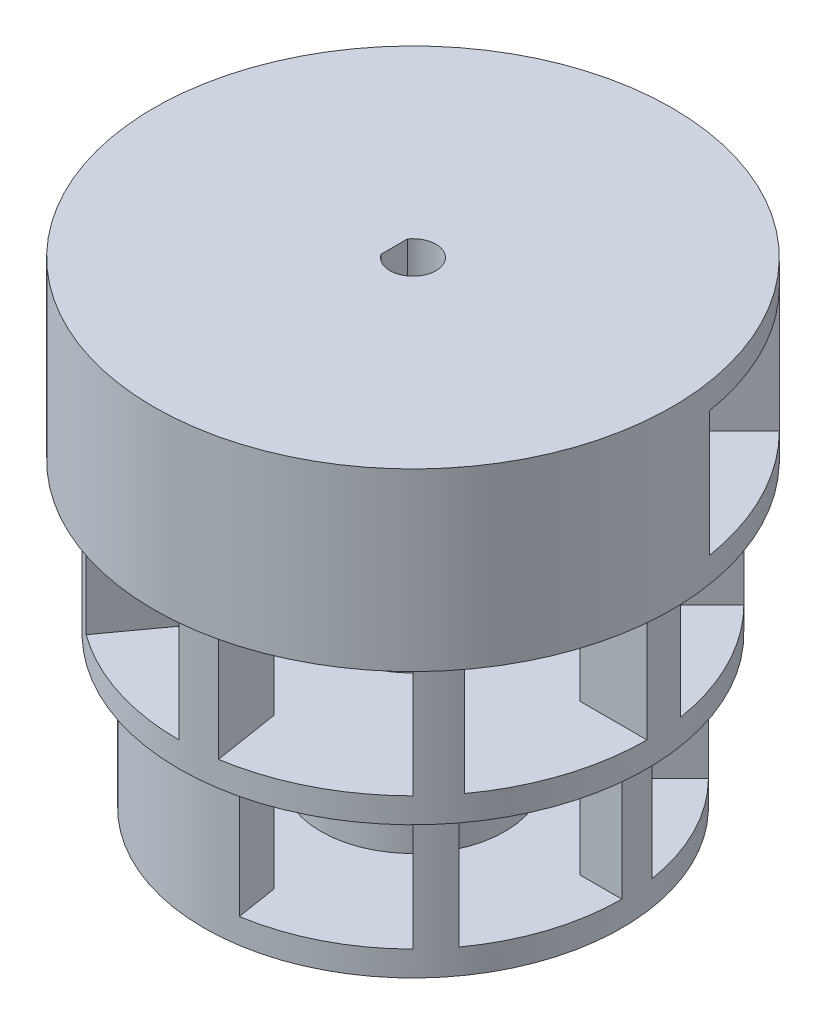
from build123d import *
from build123d.topology import SkipClean

# Parameters (mm, degrees)
SKETCH1_R           = 25
SKETCH1_R_2         = 8
BOSS_EXTRUDE1_DEPTH = 3
SKETCH2_R           = 11
BOSS_EXTRUDE2_DEPTH = 3
SKETCH3_R           = 10
SKETCH3_R_2         = 8
BOSS_EXTRUDE3_DEPTH = 15
SKETCH4_R           = 28
SKETCH4_R_2         = 8
BOSS_EXTRUDE4_DEPTH = 3
SKETCH6_R           = 10
SKETCH6_R_2         = 8
BOSS_EXTRUDE5_DEPTH = 15
SKETCH7_R           = 31
SKETCH7_R_2         = 8
BOSS_EXTRUDE6_DEPTH = 3
SKETCH9_R           = 10
SKETCH9_R_2         = 8
BOSS_EXTRUDE7_DEPTH = 15
SKETCH10_R          = 31
SKETCH10_R_2        = 8
BOSS_EXTRUDE8_DEPTH = 3
BOSS_EXTRUDE9_REACH = 73.91
SKETCH12_W          = 4.758961379
SKETCH12_H          = 12.380249671
CUT_EXTRUDE7_REACH  = 86.374
CIRPATTERN3_COUNT   = 8
CUT_EXTRUDE5_REACH  = 91.222
CIRPATTERN1_COUNT   = 8
CUT_EXTRUDE6_DEPTH  = 12.5
CIRPATTERN2_COUNT   = 8


with BuildPart() as part:
    # Sketch1 → Boss-Extrude1 (new body)
    with BuildSketch(Plane(origin=(0, 0, 0), x_dir=(1, 0, 0), z_dir=(0, 1, 0))):
        Circle(SKETCH1_R)
        Circle(SKETCH1_R_2, mode=Mode.SUBTRACT)
    extrude(amount=BOSS_EXTRUDE1_DEPTH)

    # Sketch2 → Boss-Extrude2 (add)
    with BuildSketch(Plane(origin=(0, 3, 0), x_dir=(1, 0, 0), z_dir=(0, 1, 0))):
        Circle(SKETCH2_R)
    extrude(amount=BOSS_EXTRUDE2_DEPTH)

    # Sketch3 → Boss-Extrude3 (add)
    # profile 1 of 5: a face of its own
    with BuildSketch(Plane(origin=(0, 3, 0), x_dir=(1, 0, 0), z_dir=(0, 1, 0))):
        with BuildLine():
            ThreePointArc((-11.755705046, -16.180339887), (-12.988960967, -15.208119312), (-14.142135624, -14.142135624))
            Line((-14.142135624, -14.142135624), (-16.263455967, -16.263455967))
            ThreePointArc((-16.263455967, -16.263455967), (-20.493150056, -10.441781494), (-22.716831834, -3.597992696))
            Line((-22.716831834, -3.597992696), (-19.753766812, -3.128689301))
            ThreePointArc((-19.753766812, -3.128689301), (-19.938346675, -1.569181915), (-20, 0))
            Line((-20, 0), (-23, 0))
            ThreePointArc((-23, 0), (-21.874299875, 7.107390871), (-18.607390871, 13.519060803))
            Line((-18.607390871, 13.519060803), (-16.180339887, 11.755705046))
            ThreePointArc((-16.180339887, 11.755705046), (-15.208119312, 12.988960967), (-14.142135624, 14.142135624))
            Line((-14.142135624, 14.142135624), (-16.263455967, 16.263455967))
            ThreePointArc((-16.263455967, 16.263455967), (-10.441781494, 20.493150056), (-3.597992696, 22.716831834))
            Line((-3.597992696, 22.716831834), (-3.128689301, 19.753766812))
            ThreePointArc((-3.128689301, 19.753766812), (-1.569181915, 19.938346675), (0, 20))
            Line((0, 20), (0, 25))
            ThreePointArc((0, 25), (-24.922933343, -1.961477393), (3.910861626, -24.692208515))
            Line((3.910861626, -24.692208515), (3.128689301, -19.753766812))
            ThreePointArc((3.128689301, -19.753766812), (1.569181915, -19.938346675), (0, -20))
            Line((0, -20), (0, -23))
            ThreePointArc((0, -23), (-7.107390871, -21.874299875), (-13.519060803, -18.607390871))
            Line((-13.519060803, -18.607390871), (-11.755705046, -16.180339887))
        make_face()
    # profile 2 of 5: a face of its own
    with BuildSketch(Plane(origin=(0, 3, 0), x_dir=(1, 0, 0), z_dir=(0, 1, 0))):
        with BuildLine():
            Line((14.142135624, -14.142135624), (17.67766953, -17.67766953))
            ThreePointArc((17.67766953, -17.67766953), (19.01014914, -16.236201208), (20.225424859, -14.694631307))
            Line((20.225424859, -14.694631307), (16.180339887, -11.755705046))
            ThreePointArc((16.180339887, -11.755705046), (15.208119312, -12.988960967), (14.142135624, -14.142135624))
        make_face()
    # profile 3 of 5: a face of its own
    with BuildSketch(Plane(origin=(0, 3, 0), x_dir=(1, 0, 0), z_dir=(0, 1, 0))):
        with BuildLine():
            ThreePointArc((17.67766953, 17.67766953), (16.236201208, 19.01014914), (14.694631307, 20.225424859))
            Line((14.694631307, 20.225424859), (11.755705046, 16.180339887))
            ThreePointArc((11.755705046, 16.180339887), (12.988960967, 15.208119312), (14.142135624, 14.142135624))
            Line((14.142135624, 14.142135624), (17.67766953, 17.67766953))
        make_face()
    # profile 4 of 5: a face of its own
    with BuildSketch(Plane(origin=(0, 3, 0), x_dir=(1, 0, 0), z_dir=(0, 1, 0))):
        with BuildLine():
            Line((20, 0), (25, 0))
            ThreePointArc((25, 0), (24.922933343, 1.961477393), (24.692208515, 3.910861626))
            Line((24.692208515, 3.910861626), (19.753766812, 3.128689301))
            ThreePointArc((19.753766812, 3.128689301), (19.938346675, 1.569181915), (20, 0))
        make_face()
    # profile 5 of 5: a face of its own
    with BuildSketch(Plane(origin=(0, 3, 0), x_dir=(1, 0, 0), z_dir=(0, 1, 0))):
        Circle(SKETCH3_R)
        Circle(SKETCH3_R_2, mode=Mode.SUBTRACT)
    extrude(amount=BOSS_EXTRUDE3_DEPTH)

    # Sketch4 → Boss-Extrude4 (add)
    with BuildSketch(Plane(origin=(0, 18, 0), x_dir=(1, 0, 0), z_dir=(0, 1, 0))):
        Circle(SKETCH4_R)
        Circle(SKETCH4_R_2, mode=Mode.SUBTRACT)
    extrude(amount=BOSS_EXTRUDE4_DEPTH)

    # Sketch6 → Boss-Extrude5 (add)
    # profile 1 of 9: a face of its own
    with SkipClean():  # the faces are left unmerged after this step: merging them gives an invalid solid
        with BuildSketch(Plane(origin=(0, 21, 0), x_dir=(1, 0, 0), z_dir=(0, 1, 0))):
            Circle(SKETCH6_R)
            Circle(SKETCH6_R_2, mode=Mode.SUBTRACT)
        # profile 2 of 9: a face of its own
        with BuildSketch(Plane(origin=(0, 21, 0), x_dir=(1, 0, 0), z_dir=(0, 1, 0))):
            with BuildLine():
                Line((-11.755705046, -16.180339887), (-16.457987064, -22.652475842))
                ThreePointArc((-16.457987064, -22.652475842), (-18.184545353, -21.291367037), (-19.798989873, -19.798989873))
                Line((-19.798989873, -19.798989873), (-14.142135624, -14.142135624))
                ThreePointArc((-14.142135624, -14.142135624), (-12.988960967, -15.208119312), (-11.755705046, -16.180339887))
            make_face()
        # profile 3 of 9: a face of its own
        with BuildSketch(Plane(origin=(0, 21, 0), x_dir=(1, 0, 0), z_dir=(0, 1, 0))):
            with BuildLine():
                Line((3.128689301, -19.753766812), (4.380165021, -27.655273537))
                ThreePointArc((4.380165021, -27.655273537), (2.19685468, -27.913685345), (0, -28))
                Line((0, -28), (0, -20))
                ThreePointArc((0, -20), (1.569181915, -19.938346675), (3.128689301, -19.753766812))
            make_face()
        # profile 4 of 9: a face of its own
        with BuildSketch(Plane(origin=(0, 21, 0), x_dir=(1, 0, 0), z_dir=(0, 1, 0))):
            with BuildLine():
                Line((-19.753766812, -3.128689301), (-27.655273537, -4.380165021))
                ThreePointArc((-27.655273537, -4.380165021), (-27.913685345, -2.19685468), (-28, 0))
                Line((-28, 0), (-20, 0))
                ThreePointArc((-20, 0), (-19.938346675, -1.569181915), (-19.753766812, -3.128689301))
            make_face()
        # profile 5 of 9: a face of its own
        with BuildSketch(Plane(origin=(0, 21, 0), x_dir=(1, 0, 0), z_dir=(0, 1, 0))):
            with BuildLine():
                Line((-16.180339887, 11.755705046), (-22.652475842, 16.457987064))
                ThreePointArc((-22.652475842, 16.457987064), (-21.291367037, 18.184545353), (-19.798989873, 19.798989873))
                Line((-19.798989873, 19.798989873), (-14.142135624, 14.142135624))
                ThreePointArc((-14.142135624, 14.142135624), (-15.208119312, 12.988960967), (-16.180339887, 11.755705046))
            make_face()
        # profile 6 of 9: a face of its own
        with BuildSketch(Plane(origin=(0, 21, 0), x_dir=(1, 0, 0), z_dir=(0, 1, 0))):
            with BuildLine():
                Line((-3.128689301, 19.753766812), (-4.380165021, 27.655273537))
                ThreePointArc((-4.380165021, 27.655273537), (-2.19685468, 27.913685345), (0, 28))
                Line((0, 28), (0, 20))
                ThreePointArc((0, 20), (-1.569181915, 19.938346675), (-3.128689301, 19.753766812))
            make_face()
        # profile 7 of 9: a face of its own
        with BuildSketch(Plane(origin=(0, 21, 0), x_dir=(1, 0, 0), z_dir=(0, 1, 0))):
            with BuildLine():
                Line((11.755705046, 16.180339887), (16.457987064, 22.652475842))
                ThreePointArc((16.457987064, 22.652475842), (18.184545353, 21.291367037), (19.798989873, 19.798989873))
                Line((19.798989873, 19.798989873), (14.142135624, 14.142135624))
                ThreePointArc((14.142135624, 14.142135624), (12.988960967, 15.208119312), (11.755705046, 16.180339887))
            make_face()
        # profile 8 of 9: a face of its own
        with BuildSketch(Plane(origin=(0, 21, 0), x_dir=(1, 0, 0), z_dir=(0, 1, 0))):
            with BuildLine():
                Line((19.753766812, 3.128689301), (27.655273537, 4.380165021))
                ThreePointArc((27.655273537, 4.380165021), (27.913685345, 2.19685468), (28, 0))
                Line((28, 0), (20, 0))
                ThreePointArc((20, 0), (19.938346675, 1.569181915), (19.753766812, 3.128689301))
            make_face()
        # profile 9 of 9: a face of its own
        with BuildSketch(Plane(origin=(0, 21, 0), x_dir=(1, 0, 0), z_dir=(0, 1, 0))):
            with BuildLine():
                Line((16.180339887, -11.755705046), (22.652475842, -16.457987064))
                ThreePointArc((22.652475842, -16.457987064), (21.291367037, -18.184545353), (19.798989873, -19.798989873))
                Line((19.798989873, -19.798989873), (14.142135624, -14.142135624))
                ThreePointArc((14.142135624, -14.142135624), (15.208119312, -12.988960967), (16.180339887, -11.755705046))
            make_face()
        extrude(amount=BOSS_EXTRUDE5_DEPTH)

    # Sketch7 → Boss-Extrude6 (add)
    with SkipClean():  # the faces are left unmerged after this step: merging them gives an invalid solid
        with BuildSketch(Plane(origin=(0, 36, 0), x_dir=(1, 0, 0), z_dir=(0, 1, 0))):
            Circle(SKETCH7_R)
            Circle(SKETCH7_R_2, mode=Mode.SUBTRACT)
        extrude(amount=BOSS_EXTRUDE6_DEPTH)

    # Sketch9 → Boss-Extrude7 (add)
    # profile 1 of 5: a face of its own
    with SkipClean():  # the faces are left unmerged after this step: merging them gives an invalid solid
        with BuildSketch(Plane(origin=(0, 39, 0), x_dir=(1, 0, 0), z_dir=(0, 1, 0))):
            with BuildLine():
                ThreePointArc((3.128689301, -19.753766812), (1.569181915, -19.938346675), (0, -20))
                Line((0, -20), (0, -28))
                ThreePointArc((0, -28), (-8.652475842, -26.629582456), (-16.457987064, -22.652475842))
                Line((-16.457987064, -22.652475842), (-11.755705046, -16.180339887))
                ThreePointArc((-11.755705046, -16.180339887), (-12.988960967, -15.208119312), (-14.142135624, -14.142135624))
                Line((-14.142135624, -14.142135624), (-19.798989873, -19.798989873))
                ThreePointArc((-19.798989873, -19.798989873), (-24.948182677, -12.711733993), (-27.655273537, -4.380165021))
                Line((-27.655273537, -4.380165021), (-19.753766812, -3.128689301))
                ThreePointArc((-19.753766812, -3.128689301), (-19.938346675, -1.569181915), (-20, 0))
                Line((-20, 0), (-31, 0))
                ThreePointArc((-31, 0), (2.432231968, -30.904437346), (30.618338558, 4.849468416))
                Line((30.618338558, 4.849468416), (19.753766812, 3.128689301))
                ThreePointArc((19.753766812, 3.128689301), (19.938346675, 1.569181915), (20, 0))
                Line((20, 0), (28, 0))
                ThreePointArc((28, 0), (26.629582456, -8.652475842), (22.652475842, -16.457987064))
                Line((22.652475842, -16.457987064), (16.180339887, -11.755705046))
                ThreePointArc((16.180339887, -11.755705046), (15.208119312, -12.988960967), (14.142135624, -14.142135624))
                Line((14.142135624, -14.142135624), (19.798989873, -19.798989873))
                ThreePointArc((19.798989873, -19.798989873), (12.711733993, -24.948182677), (4.380165021, -27.655273537))
                Line((4.380165021, -27.655273537), (3.128689301, -19.753766812))
            make_face()
        # profile 2 of 5: a face of its own
        with BuildSketch(Plane(origin=(0, 39, 0), x_dir=(1, 0, 0), z_dir=(0, 1, 0))):
            with BuildLine():
                ThreePointArc((-21.920310217, 21.920310217), (-23.572584934, 20.132889498), (-25.079526826, 18.221342821))
                Line((-25.079526826, 18.221342821), (-16.180339887, 11.755705046))
                ThreePointArc((-16.180339887, 11.755705046), (-15.208119312, 12.988960967), (-14.142135624, 14.142135624))
                Line((-14.142135624, 14.142135624), (-21.920310217, 21.920310217))
            make_face()
        # profile 3 of 5: a face of its own
        with BuildSketch(Plane(origin=(0, 39, 0), x_dir=(1, 0, 0), z_dir=(0, 1, 0))):
            with BuildLine():
                ThreePointArc((0, 31), (-2.432231968, 30.904437346), (-4.849468416, 30.618338558))
                Line((-4.849468416, 30.618338558), (-3.128689301, 19.753766812))
                ThreePointArc((-3.128689301, 19.753766812), (-1.569181915, 19.938346675), (0, 20))
                Line((0, 20), (0, 31))
            make_face()
        # profile 4 of 5: a face of its own
        with BuildSketch(Plane(origin=(0, 39, 0), x_dir=(1, 0, 0), z_dir=(0, 1, 0))):
            with BuildLine():
                Line((14.142135624, 14.142135624), (21.920310217, 21.920310217))
                ThreePointArc((21.920310217, 21.920310217), (20.132889498, 23.572584934), (18.221342821, 25.079526826))
                Line((18.221342821, 25.079526826), (11.755705046, 16.180339887))
                ThreePointArc((11.755705046, 16.180339887), (12.988960967, 15.208119312), (14.142135624, 14.142135624))
            make_face()
        # profile 5 of 5: a face of its own
        with BuildSketch(Plane(origin=(0, 39, 0), x_dir=(1, 0, 0), z_dir=(0, 1, 0))):
            Circle(SKETCH9_R)
            Circle(SKETCH9_R_2, mode=Mode.SUBTRACT)
        extrude(amount=BOSS_EXTRUDE7_DEPTH)

    # Sketch10 → Boss-Extrude8 (add)
    with SkipClean():  # the faces are left unmerged after this step: merging them gives an invalid solid
        with BuildSketch(Plane(origin=(0, 54, 0), x_dir=(1, 0, 0), z_dir=(0, 1, 0))):
            Circle(SKETCH10_R)
            Circle(SKETCH10_R_2, mode=Mode.SUBTRACT)
        extrude(amount=BOSS_EXTRUDE8_DEPTH)

    # Sketch11 → Revolve1 (revolve)
    with SkipClean():  # the faces are left unmerged after this step: merging them gives an invalid solid
        with BuildSketch(Plane.XY):
            with BuildLine():
                Line((8, 57), (2.75, 57))
                Line((2.75, 57), (2.75, 47))
                Line((2.75, 47), (0, 47))
                Line((0, 47), (0, 44.5))
                ThreePointArc((0, 44.5), (4.274049777, 45.659724015), (7.375696967, 48.820775422))
                Line((7.375696967, 48.820775422), (8, 48.820775422))
                Line((8, 48.820775422), (8, 57))
            make_face()
        revolve(axis=Axis((0, 42, 0), (0, 1, 0)))

    # Sketch12 → Boss-Extrude9 (add, up to next)
    with BuildSketch(Plane(origin=(0, 57, 0), x_dir=(1, 0, 0), z_dir=(0, 1, 0)), mode=Mode.PRIVATE) as boss_extrude9_sk1:
        with Locations((-4.62948069, 1.046540224)):
            Rectangle(SKETCH12_W, SKETCH12_H)
    boss_extrude9_tool1 = extrude(boss_extrude9_sk1.sketch, amount=-BOSS_EXTRUDE9_REACH, mode=Mode.PRIVATE) - part.part
    add(boss_extrude9_tool1.solids().sort_by_distance((-4.629481, 57, -1.04654))[0])

    # Sketch20 → Cut-Extrude7 (cut, up to next)
    with BuildSketch(Plane(origin=(16.947951218, 0, -8.635412462), x_dir=(-0.45399049973953803, 0, -0.8910065241883723), z_dir=(0.8910065241883723, 0, -0.45399049973953803)), mode=Mode.PRIVATE) as cut_extrude7_sk1:
        with BuildLine():
            Line((-1.75, 8), (-1.75, 16))
            ThreePointArc((-1.75, 16), (0, 17.75), (1.75, 16))
            Line((1.75, 16), (1.75, 8))
            ThreePointArc((1.75, 8), (0, 6.25), (-1.75, 8))
        make_face()
    cut_extrude7_tool1 = extrude(cut_extrude7_sk1.sketch, amount=-CUT_EXTRUDE7_REACH, mode=Mode.PRIVATE) & part.part
    cut_extrude7 = cut_extrude7_tool1.solids().sort_by_distance((16.947951, 12, -8.635412))[0]
    add(cut_extrude7, mode=Mode.SUBTRACT)

    # CirPattern3: Cut-Extrude7 ×8 about axis
    with SkipClean():  # the faces are left unmerged after this step: merging them gives an invalid solid
        cirpattern3_axis = Axis((0, 3, 0), (0, -1, 0))
        for i in range(1, CIRPATTERN3_COUNT):
            add(cut_extrude7.rotate(cirpattern3_axis, i * 360 / CIRPATTERN3_COUNT), mode=Mode.SUBTRACT)

    # Sketch18 → Cut-Extrude5 (cut, up to next)
    with BuildSketch(Plane(origin=(8.228993532, 0, -25.326237921), x_dir=(-0.9510565162951508, 0, -0.30901699437495617), z_dir=(0.30901699437495617, 0, -0.9510565162951508)), mode=Mode.PRIVATE) as cut_extrude5_sk1:
        with BuildLine():
            Line((-2, 24.20829429), (-2, 32.20829429))
            ThreePointArc((-2, 32.20829429), (0, 34.20829429), (2, 32.20829429))
            Line((2, 32.20829429), (2, 24.20829429))
            ThreePointArc((2, 24.20829429), (0, 22.20829429), (-2, 24.20829429))
        make_face()
    cut_extrude5_tool1 = extrude(cut_extrude5_sk1.sketch, amount=-CUT_EXTRUDE5_REACH, mode=Mode.PRIVATE) & part.part
    cut_extrude5 = cut_extrude5_tool1.solids().sort_by_distance((8.228994, 28.208294, -25.326238))[0]
    add(cut_extrude5, mode=Mode.SUBTRACT)

    # CirPattern1: Cut-Extrude5 ×8 about axis
    with SkipClean():  # the faces are left unmerged after this step: merging them gives an invalid solid
        cirpattern1_axis = Axis((0, 57, 0), (0, -1, 0))
        for i in range(1, CIRPATTERN1_COUNT):
            add(cut_extrude5.rotate(cirpattern1_axis, i * 360 / CIRPATTERN1_COUNT), mode=Mode.SUBTRACT)

    # Sketch19 → Cut-Extrude6 (cut)
    with SkipClean():  # the faces are left unmerged after this step: merging them gives an invalid solid
        with BuildSketch(Plane(origin=(16.947951218, 0, -8.635412462), x_dir=(-0.453990499739537, 0, -0.8910065241883729), z_dir=(0.8910065241883728, 0, -0.4539904997395369))):
            with BuildLine():
                Line((2.25, 51), (2.25, 42))
                ThreePointArc((2.25, 42), (0, 39.75), (-2.25, 42))
                Line((-2.25, 42), (-2.25, 51))
                ThreePointArc((-2.25, 51), (0, 53.25), (2.25, 51))
            make_face()
        cut_extrude6 = extrude(amount=-CUT_EXTRUDE6_DEPTH, mode=Mode.SUBTRACT)

    # CirPattern2: Cut-Extrude6 ×8 about axis
    with SkipClean():  # the faces are left unmerged after this step: merging them gives an invalid solid
        cirpattern2_axis = Axis((0, 39, 0), (0, -1, 0))
        for i in range(1, CIRPATTERN2_COUNT):
            add(cut_extrude6.rotate(cirpattern2_axis, i * 360 / CIRPATTERN2_COUNT), mode=Mode.SUBTRACT)


solid = part.part
